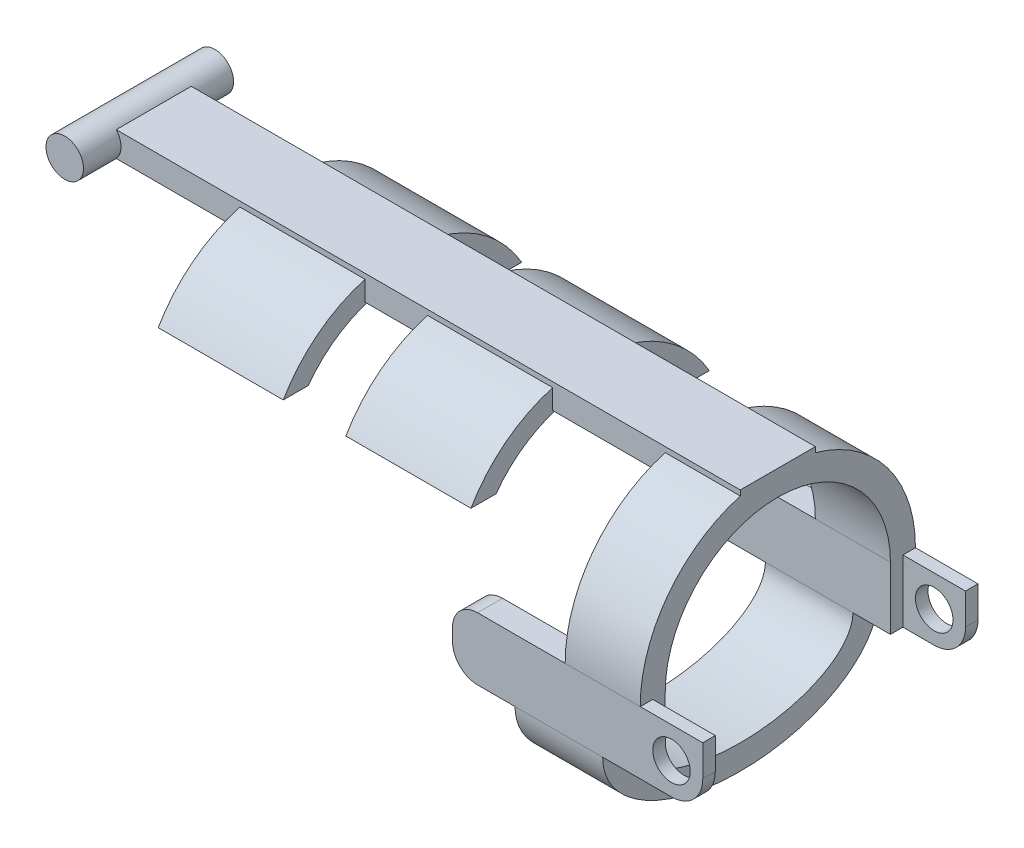
from build123d import *

# Parameters (mm, degrees)
SKETCH1_W                = 2
SKETCH1_H                = 5
BOSS_EXTRUDE1_DEPTH      = 15
BOSS_EXTRUDE1_2_DEPTH    = 15
SKETCH2_W                = 1
SKETCH2_H                = 5
BOSS_EXTRUDE2_DEPTH      = 5
CUT_EXTRUDE1_DEPTH       = 30.107559156
CUT_EXTRUDE1_DEPTH_BACK  = 30.107559156
SKETCH3_R                = 1.5
SWEEP1_START             = 9
SWEEP1_DEPTH             = 6
BOSS_EXTRUDE3_DEPTH      = 12
CUT_EXTRUDE2_DEPTH       = 5
FILLET1_R                = 2
BOSS_EXTRUDE6_START      = -6
SKETCH7_W                = 6
SKETCH7_H                = 2
BOSS_EXTRUDE6_DEPTH      = 51
BOSS_EXTRUDE7_DEPTH      = 3
BOSS_EXTRUDE7_DEPTH_BACK = 9
SKETCH8_R                = 1.5
FILLET2_R                = 2.5
BOSS_EXTRUDE10_DEPTH     = 10
LPATTERN1_COUNT          = 2
LPATTERN1_PITCH          = 15


# Read off the part's stored shape, not the designer's step: Sweep1
with BuildPart() as part:
    # Sketch1 → Boss-Extrude1 (new body)
    with BuildSketch(Plane(origin=(0, 0, 0), x_dir=(0, 0, -1), z_dir=(1, 0, 0))):
        with Locations((-10, 0)):
            Rectangle(SKETCH1_W, SKETCH1_H)
    extrude(amount=BOSS_EXTRUDE1_DEPTH)



with BuildPart() as body_2:
    # Sketch1 → Boss-Extrude1 2 (new body)
    with BuildSketch(Plane(origin=(0, 0, 0), x_dir=(0, 0, -1), z_dir=(1, 0, 0))):
        with Locations((10, 0)):
            Rectangle(SKETCH1_W, SKETCH1_H)
    extrude(amount=BOSS_EXTRUDE1_2_DEPTH)


with BuildPart() as part_1:
    add(part.part)

    add(body_2.part)  # Boss-Extrude2 merges body 2
    # Sketch2 → Boss-Extrude2 (add)
    with BuildSketch(Plane(origin=(15, 0, 0), x_dir=(0, 0, -1), z_dir=(1, 0, 0))):
        with Locations((10.5, 0)):
            Rectangle(SKETCH2_W, SKETCH2_H)
        with Locations((-10.5, 0)):
            Rectangle(SKETCH2_W, SKETCH2_H)
    extrude(amount=BOSS_EXTRUDE2_DEPTH)

    # Sketch3 → Cut-Extrude1 (cut, two sides: drawn at the far end of the back side and taken through both)
    with BuildSketch(Plane.XY.offset(-10).offset(-CUT_EXTRUDE1_DEPTH_BACK)):
        with Locations((17.5, 0)):
            Circle(SKETCH3_R)
    extrude(amount=CUT_EXTRUDE1_DEPTH + CUT_EXTRUDE1_DEPTH_BACK, mode=Mode.SUBTRACT)

    # Sweep1 outline → Sweep1 (add)
    with BuildSketch(Plane.YZ.offset(SWEEP1_START)):
        with BuildLine():
            ThreePointArc((2.5, -11), (13.5, 0), (2.5, 11))
            Line((2.5, 11), (2.5, 9))
            ThreePointArc((2.5, 9), (11.5, 0), (2.5, -9))
            Line((2.5, -9), (2.5, -11))
        make_face()
    extrude(amount=SWEEP1_DEPTH)

    # Sketch5 → Boss-Extrude3 (add)
    with BuildSketch(Plane(origin=(0, 0, 0), x_dir=(0, 0, -1), z_dir=(1, 0, 0))):
        with BuildLine():
            Line((-9, -2.5), (-11, -2.5))
            add(Edge.make_bspline(
                [(-11, -2.5), (-11, -8.980170496), (0, -8.980170496)],
                knots=[3.141592654, 3.141592654, 3.141592654, 4.71238898, 4.71238898, 4.71238898], degree=2, weights=[1, 0.707106781, 1]))
            Line((0, -8.980170496), (0, -7.009343108))
            add(Edge.make_bspline(
                [(-9, -2.5), (-9, -7.009343108), (0, -7.009343108)],
                knots=[3.141592654, 3.141592654, 3.141592654, 4.71238898, 4.71238898, 4.71238898], degree=2, weights=[1, 0.707106781, 1]))
        make_face()
    boss_extrude3 = extrude(amount=BOSS_EXTRUDE3_DEPTH)

    # Sketch6 → Cut-Extrude2 (cut)
    with BuildSketch(Plane.ZY):
        with BuildLine():
            Line((11, -2.5), (9, -2.5))
            add(Edge.make_bspline(
                [(0, -7.009343108), (9, -7.009343108), (9, -2.5)],
                knots=[4.71238898, 4.71238898, 4.71238898, 6.283185307, 6.283185307, 6.283185307], degree=2, weights=[1, 0.707106781, 1]))
            Line((0, -7.009343108), (0, -8.980170496))
            add(Edge.make_bspline(
                [(0, -8.980170496), (11, -8.980170496), (11, -2.5)],
                knots=[4.71238898, 4.71238898, 4.71238898, 6.283185307, 6.283185307, 6.283185307], degree=2, weights=[1, 0.707106781, 1]))
        make_face()
    cut_extrude2 = extrude(amount=-CUT_EXTRUDE2_DEPTH, mode=Mode.SUBTRACT)

    # Mirror2: Boss-Extrude3, Cut-Extrude2 across plane
    add(boss_extrude3.mirror(Plane(origin=(12, -8.980170496, 0), x_dir=(1, 0, 0), z_dir=(0, 0, 1))))
    add(cut_extrude2.mirror(Plane(origin=(12, -8.980170496, 0), x_dir=(1, 0, 0), z_dir=(0, 0, 1))), mode=Mode.SUBTRACT)

    # Fillet1
    fillet1_edges = [part_1.edges().sort_by_distance(p)[0] for p in [
        (0, -2.5, -10),
        (0, 2.5, -10),
        (0, 2.5, 10),
        (0, -2.5, 10),
    ]]
    fillet(fillet1_edges, radius=FILLET1_R)

    # Sketch7 → Boss-Extrude6 (add)
    with BuildSketch(Plane.ZY.offset(-9).offset(BOSS_EXTRUDE6_START)):
        with Locations((0, 12.5)):
            Rectangle(SKETCH7_W, SKETCH7_H)
    extrude(amount=BOSS_EXTRUDE6_DEPTH)

    # Sketch8 → Boss-Extrude7 (add, two sides: drawn at the far end of the back side and taken through both)
    with BuildSketch(Plane.XY.offset(3).offset(-BOSS_EXTRUDE7_DEPTH_BACK)):
        with Locations((-36, 12.5)):
            Circle(SKETCH8_R)
    extrude(amount=BOSS_EXTRUDE7_DEPTH + BOSS_EXTRUDE7_DEPTH_BACK)

    # Fillet2
    fillet2_edges = [part_1.edges().sort_by_distance(p)[0] for p in [
        (20, -2.5, -10.5),
        (20, -2.5, 10.5),
    ]]
    fillet(fillet2_edges, radius=FILLET2_R)

    # 3DSketch3 → Boss-Extrude10 (add)
    with BuildSketch(Plane(origin=(-10, 7.995255445, 9.529017137), x_dir=(0, 0, -1), z_dir=(1, 0, 0))):
        with BuildLine():
            Line((0, 0), (2, 0))
            ThreePointArc((2, 0), (9.529017137, 3.825899604), (17.058034273, 0))
            Line((17.058034273, 0), (19.058034273, 0))
            ThreePointArc((19.058034273, 0), (15.031388903, 4.029654263), (9.529017137, 5.504744555))
            ThreePointArc((9.529017137, 5.504744555), (4.026645371, 4.029654263), (0, 0))
        make_face()
    boss_extrude10 = extrude(amount=BOSS_EXTRUDE10_DEPTH)

    # LPattern1: Boss-Extrude10 ×2
    with Locations(*[(-i * LPATTERN1_PITCH, 0, 0) for i in range(1, LPATTERN1_COUNT)]):
        add(boss_extrude10)


solid = part_1.part
